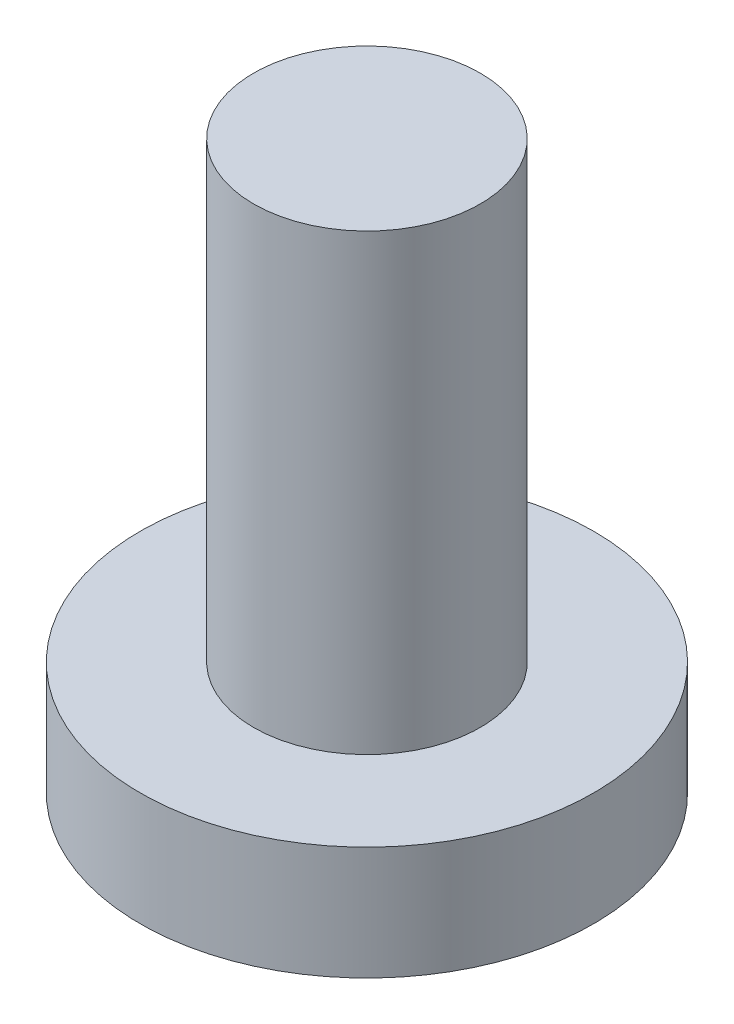
from build123d import *


with BuildPart() as part:
    # Sketch1 → Revolve1 (revolve)
    with BuildSketch(Plane.XY):
        Polygon((0, 10), (0, 0), (4, 0), (4, 2), (2, 2), (2, 10), align=None)
    revolve(axis=Axis((0, -3.367088608, 0), (0, 1, 0)))


solid = part.part
